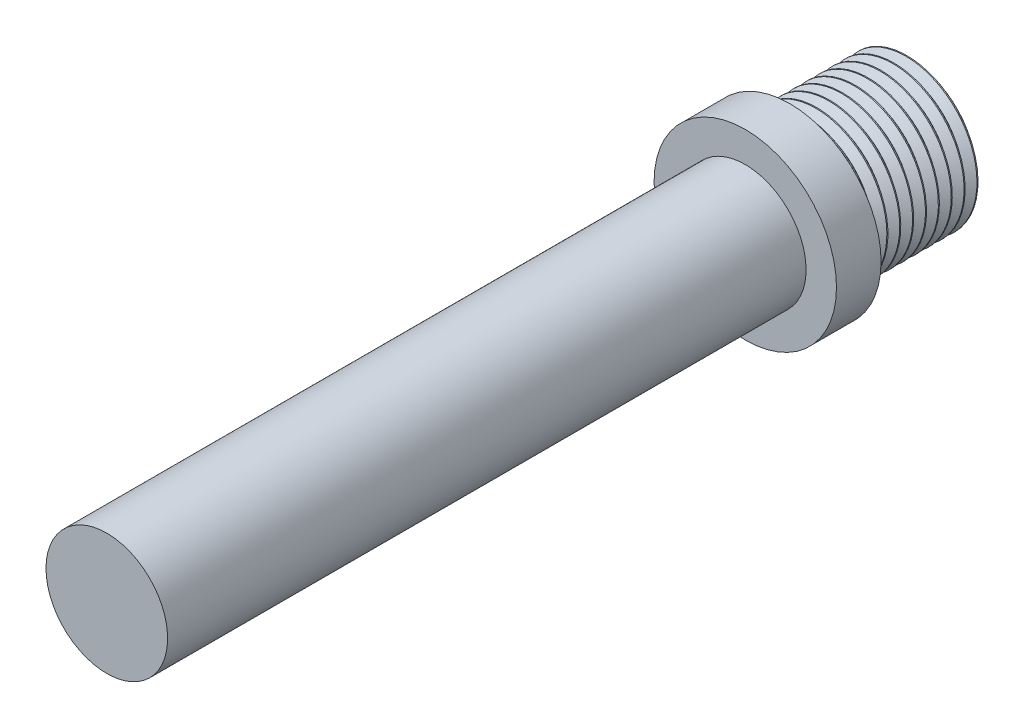
from build123d import *

# Parameters (mm, degrees)
ROSCA_PITCH = 1.27
ROSCA_TO    = 12


with BuildPart() as part:
    # Sk_Eje → Eje (revolve)
    with BuildSketch(Plane(origin=(0, 0, 0), x_dir=(1, 0, 0), z_dir=(0, 1, 0)), mode=Mode.PRIVATE) as eje_sk:
        Polygon((172.5, -67.1), (179.645, -67.1), (179.645, -79.1), (181.5, -79.1), (181.5, -83.5), (178.5, -83.5), (178.5, -146.5), (172.5, -146.5), align=None)
    revolve(eje_sk.sketch.rotate(Axis((172.5, 0, 62.1), (0, 0, 1)), 180), axis=Axis((172.5, 0, 62.1), (0, 0, 1)))

    # Rosca: arcs per turn and ends read off the stored shape
    # Rosca: the profile of Sk_filete screwed along a left-hand helix through 12 turns, 8 arcs to a turn; built about Z, then put on its axis
    rosca_z = Axis((0, 0, 0), (0, 0, 1))
    rosca_corners = [(7.445, 0, -2.075), (7.445, 0, -0.465), (6.365982, 0, -1.27)]
    with BuildLine(mode=Mode.PRIVATE) as rosca_profile:
        Line(rosca_corners[0], rosca_corners[1])
        Line(rosca_corners[1], rosca_corners[2])
        Line(rosca_corners[2], rosca_corners[0])
    rosca_cap = Face(rosca_profile.wire())
    rosca_turn_angles = [0, -22.5, -45, -67.5, -90, -112.5, -135, -157.5, -180, -202.5, -225, -247.5, -270, -292.5, -315, -337.5, -360]
    rosca_turn_weights = [1, 0.9238795325112867, 1, 0.9238795325112867, 1, 0.9238795325112867, 1, 0.9238795325112867, 1, 0.9238795325112867, 1, 0.9238795325112867, 1, 0.9238795325112867, 1, 0.9238795325112867, 1]
    rosca_turn_rails = [Edge.make_bspline([Vector(p[0], p[1], 0).rotate(rosca_z, rosca_turn_angles[k]) / rosca_turn_weights[k] + Vector(0, 0, p[2] + -ROSCA_PITCH * rosca_turn_angles[k] / 360) for k in range(17)], [0, 0, 0, 1, 1, 2, 2, 3, 3, 4, 4, 5, 5, 6, 6, 7, 7, 8, 8, 8], 2, rosca_turn_weights) for p in rosca_corners]
    rosca_turn_sides = [Face.make_surface_from_curves(rosca_turn_rails[p[0]], rosca_turn_rails[p[1]]) for p in [(0, 1), (1, 2), (2, 0)]]
    rosca_turn = Solid(Shell([*rosca_turn_sides, rosca_cap, rosca_cap.rotate(rosca_z, -360).moved(Location((0, 0, -ROSCA_PITCH * -360 / 360)))]))
    rosca_each = [*[rosca_turn.moved(Location((0, 0, ROSCA_PITCH * i))) for i in range(12)]]
    add(Plane(origin=(172.5, 0, 67.1), x_dir=(1, 0, 0), z_dir=(0, 0, 1)) * split(Compound([rosca_each[i] for i in range(0, 12, 2)]), bisect_by=Plane.XY.offset(ROSCA_TO), keep=Keep.BOTTOM, mode=Mode.PRIVATE), mode=Mode.SUBTRACT)
    add(Plane(origin=(172.5, 0, 67.1), x_dir=(1, 0, 0), z_dir=(0, 0, 1)) * split(Compound([rosca_each[i] for i in range(1, 12, 2)]), bisect_by=Plane.XY.offset(ROSCA_TO), keep=Keep.BOTTOM, mode=Mode.PRIVATE), mode=Mode.SUBTRACT)


solid = part.part
